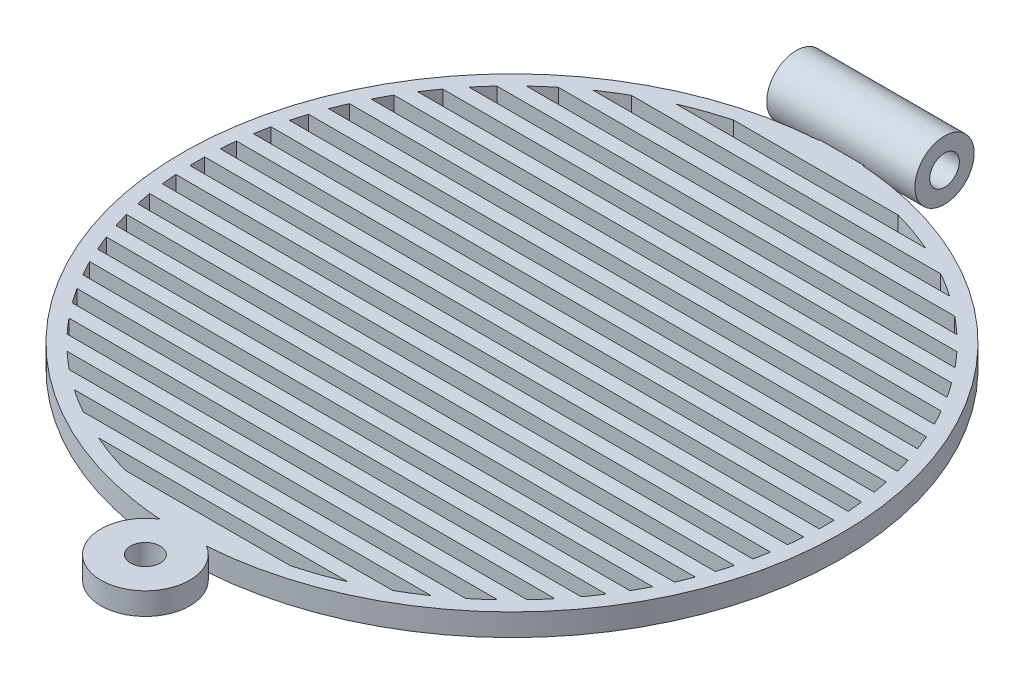
from build123d import *

# Parameters (mm, degrees)
SKETCH1_R                = 3
SKETCH1_R_2              = 1
SKETCH1_RX               = 22.24
SKETCH1_RY               = 22.24
SKETCH1_RX_2             = 21.24
SKETCH1_RY_2             = 21.24
SKETCH1_W                = 3
SKETCH1_H                = 2
BOSS_EXTRUDE1_DEPTH      = 1.5
BOSS_EXTRUDE2_DEPTH      = 5
BOSS_EXTRUDE2_DEPTH_BACK = 5
SKETCH2_R                = 2
SKETCH2_R_2              = 1
SKETCH4_R                = 1
CUT_EXTRUDE1_DEPTH       = 40.08356702
BOSS_EXTRUDE3_DEPTH      = 1.5
SKETCH6_W                = 0.2
SKETCH6_H                = 2.484462433
SKETCH6_H_2              = 1.927601492
SKETCH6_H_3              = 2
SKETCH6_H_4              = 1
SKETCH6_H_5              = 1.587936075
SKETCH6_H_6              = 2.60478701
SKETCH6_H_7              = 1.881862502
SKETCH6_H_8              = 1.513350488
BOSS_EXTRUDE4_DEPTH      = 0.5


with BuildPart() as part:
    # Sketch1 → Boss-Extrude1 (new body)
    # profile 1 of 3: a face of its own
    with BuildSketch(Plane(origin=(0, 0, 0), x_dir=(1, 0, 0), z_dir=(0, 1, 0))):
        with Locations((0, -24.74)):
            Circle(SKETCH1_R)
        with Locations(Location((0, -24.74, 0), (0, 0, 270))):
            Circle(SKETCH1_R_2, mode=Mode.SUBTRACT)
    # profile 2 of 3: a face of its own
    with BuildSketch(Plane(origin=(0, 0, 0), x_dir=(1, 0, 0), z_dir=(0, 1, 0))):
        with Locations(Location((0, 0), (0, 0, -180))):
            Ellipse(SKETCH1_RX, SKETCH1_RY)
        with Locations(Location((0, 0), (0, 0, 180))):
            Ellipse(SKETCH1_RX_2, SKETCH1_RY_2, mode=Mode.SUBTRACT)
    # profile 3 of 3: a face of its own
    with BuildSketch(Plane(origin=(0, 0, 0), x_dir=(1, 0, 0), z_dir=(0, 1, 0))):
        with Locations((0, 23.18935781)):
            Rectangle(SKETCH1_W, SKETCH1_H)
    extrude(amount=BOSS_EXTRUDE1_DEPTH)

    # Sketch2 → Boss-Extrude2 (add, two sides: drawn at the far end of the back side and taken through both)
    with BuildSketch(Plane(origin=(0, 0, 0), x_dir=(0, 0, -1), z_dir=(1, 0, 0)).offset(-BOSS_EXTRUDE2_DEPTH_BACK)):
        with Locations((24.18935781, 2)):
            Circle(SKETCH2_R)
        with Locations((24.18935781, 2)):
            Circle(SKETCH2_R_2, mode=Mode.SUBTRACT)
    extrude(amount=BOSS_EXTRUDE2_DEPTH + BOSS_EXTRUDE2_DEPTH_BACK)

    # Sketch4 → Cut-Extrude1 (cut, through all)
    with BuildSketch(Plane(origin=(5, 0, 0), x_dir=(0, 0, -1), z_dir=(1, 0, 0))):
        with Locations((24.18935781, 2)):
            Circle(SKETCH4_R)
    extrude(amount=-CUT_EXTRUDE1_DEPTH, mode=Mode.SUBTRACT)

    # Sketch5 → Boss-Extrude3 (add)
    with BuildSketch(Plane(origin=(0, 1.5, 0), x_dir=(1, 0, 0), z_dir=(0, 1, 0))):
        with BuildLine():
            Line((21.234114062, -0.5), (-21.234114062, -0.5))
            add(Edge.make_bspline(
                [(-21.234114062, -0.5), (-21.22232747, -1.000555695), (-21.186967692, -1.5)],
                knots=[3.165135318, 3.165135318, 3.165135318, 3.212272957, 3.212272957, 3.212272957], degree=2, weights=[1, 0.999722268, 1]))
            Line((-21.186967692, -1.5), (21.186967692, -1.5))
            add(Edge.make_bspline(
                [(21.186967692, -1.5), (21.22232747, -1.000555695), (21.234114062, -0.5)],
                knots=[6.212505003, 6.212505003, 6.212505003, 6.259642643, 6.259642643, 6.259642643], degree=2, weights=[1, 0.999722268, 1]))
        make_face()
        with BuildLine():
            add(Edge.make_bspline(
                [(-21.186967692, 1.5), (-21.22232747, 1.000555695), (-21.234114062, 0.5)],
                knots=[3.07091235, 3.07091235, 3.07091235, 3.118049989, 3.118049989, 3.118049989], degree=2, weights=[1, 0.999722268, 1]))
            Line((-21.234114062, 0.5), (21.234114062, 0.5))
            add(Edge.make_bspline(
                [(21.234114062, 0.5), (21.22232747, 1.000555695), (21.186967692, 1.5)],
                knots=[0.023542664, 0.023542664, 0.023542664, 0.070680304, 0.070680304, 0.070680304], degree=2, weights=[1, 0.999722268, 1]))
            Line((21.186967692, 1.5), (-21.186967692, 1.5))
        make_face()
        with BuildLine():
            add(Edge.make_bspline(
                [(-20.949644388, 3.5), (-21.032894465, 3.001697284), (-21.092358806, 2.5)],
                knots=[2.97605422, 2.97605422, 2.97605422, 3.023616725, 3.023616725, 3.023616725], degree=2, weights=[1, 0.999717239, 1]))
            Line((-21.092358806, 2.5), (21.092358806, 2.5))
            add(Edge.make_bspline(
                [(21.092358806, 2.5), (21.032894465, 3.001697284), (20.949644388, 3.5)],
                knots=[0.117975929, 0.117975929, 0.117975929, 0.165538433, 0.165538433, 0.165538433], degree=2, weights=[1, 0.999717239, 1]))
            Line((20.949644388, 3.5), (-20.949644388, 3.5))
        make_face()
        with BuildLine():
            add(Edge.make_bspline(
                [(-20.515545325, 5.5), (-20.648803138, 5.002935148), (-20.757832257, 4.5)],
                knots=[2.879662466, 2.879662466, 2.879662466, 2.928110373, 2.928110373, 2.928110373], degree=2, weights=[1, 0.999706614, 1]))
            Line((-20.757832257, 4.5), (20.757832257, 4.5))
            add(Edge.make_bspline(
                [(20.757832257, 4.5), (20.648803138, 5.002935148), (20.515545325, 5.5)],
                knots=[0.21348228, 0.21348228, 0.21348228, 0.261930188, 0.261930188, 0.261930188], degree=2, weights=[1, 0.999706614, 1]))
            Line((20.515545325, 5.5), (-20.515545325, 5.5))
        make_face()
        with BuildLine():
            add(Edge.make_bspline(
                [(-19.871778984, 7.5), (-20.058845232, 7.004354782), (-20.220969314, 6.5)],
                knots=[2.78070233, 2.78070233, 2.78070233, 2.830576322, 2.830576322, 2.830576322], degree=2, weights=[1, 0.999689089, 1]))
            Line((-20.220969314, 6.5), (20.220969314, 6.5))
            add(Edge.make_bspline(
                [(20.220969314, 6.5), (20.058845232, 7.004354782), (19.871778984, 7.5)],
                knots=[0.311016332, 0.311016332, 0.311016332, 0.360890324, 0.360890324, 0.360890324], degree=2, weights=[1, 0.999689089, 1]))
            Line((19.871778984, 7.5), (-19.871778984, 7.5))
        make_face()
        with BuildLine():
            Line((21.092358806, -2.5), (-21.092358806, -2.5))
            add(Edge.make_bspline(
                [(-21.092358806, -2.5), (-21.032894465, -3.001697284), (-20.949644388, -3.5)],
                knots=[3.259568583, 3.259568583, 3.259568583, 3.307131087, 3.307131087, 3.307131087], degree=2, weights=[1, 0.999717239, 1]))
            Line((-20.949644388, -3.5), (20.949644388, -3.5))
            add(Edge.make_bspline(
                [(20.949644388, -3.5), (21.032894465, -3.001697284), (21.092358806, -2.5)],
                knots=[6.117646874, 6.117646874, 6.117646874, 6.165209378, 6.165209378, 6.165209378], degree=2, weights=[1, 0.999717239, 1]))
        make_face()
        with BuildLine():
            Line((20.757832257, -4.5), (-20.757832257, -4.5))
            add(Edge.make_bspline(
                [(-20.757832257, -4.5), (-20.648803138, -5.002935148), (-20.515545325, -5.5)],
                knots=[3.355074934, 3.355074934, 3.355074934, 3.403522841, 3.403522841, 3.403522841], degree=2, weights=[1, 0.999706614, 1]))
            Line((-20.515545325, -5.5), (20.515545325, -5.5))
            add(Edge.make_bspline(
                [(20.515545325, -5.5), (20.648803138, -5.002935148), (20.757832257, -4.5)],
                knots=[6.021255119, 6.021255119, 6.021255119, 6.069703027, 6.069703027, 6.069703027], degree=2, weights=[1, 0.999706614, 1]))
        make_face()
        with BuildLine():
            Line((20.220969314, -6.5), (-20.220969314, -6.5))
            add(Edge.make_bspline(
                [(-20.220969314, -6.5), (-20.058845232, -7.004354782), (-19.871778984, -7.5)],
                knots=[3.452608985, 3.452608985, 3.452608985, 3.502482977, 3.502482977, 3.502482977], degree=2, weights=[1, 0.999689089, 1]))
            Line((-19.871778984, -7.5), (19.871778984, -7.5))
            add(Edge.make_bspline(
                [(19.871778984, -7.5), (20.058845232, -7.004354782), (20.220969314, -6.5)],
                knots=[5.922294984, 5.922294984, 5.922294984, 5.972168976, 5.972168976, 5.972168976], degree=2, weights=[1, 0.999689089, 1]))
        make_face()
        with BuildLine():
            Line((19.46503532, -8.5), (-19.46503532, -8.5))
            add(Edge.make_bspline(
                [(-19.46503532, -8.5), (-19.244038415, -9.00608383), (-18.997041875, -9.5)],
                knots=[3.553314987, 3.553314987, 3.553314987, 3.605302547, 3.605302547, 3.605302547], degree=2, weights=[1, 0.999662181, 1]))
            Line((-18.997041875, -9.5), (18.997041875, -9.5))
            add(Edge.make_bspline(
                [(18.997041875, -9.5), (19.244038415, -9.00608383), (19.46503532, -8.5)],
                knots=[5.819475414, 5.819475414, 5.819475414, 5.871462974, 5.871462974, 5.871462974], degree=2, weights=[1, 0.999662181, 1]))
        make_face()
        with BuildLine():
            Line((18.463141661, -10.5), (-18.463141661, -10.5))
            add(Edge.make_bspline(
                [(-18.463141661, -10.5), (-18.174049249, -11.008338491), (-17.857424226, -11.5)],
                knots=[3.658679891, 3.658679891, 3.658679891, 3.713731205, 3.713731205, 3.713731205], degree=2, weights=[1, 0.999621193, 1]))
            Line((-17.857424226, -11.5), (17.857424226, -11.5))
            add(Edge.make_bspline(
                [(17.857424226, -11.5), (18.174049249, -11.008338491), (18.463141661, -10.5)],
                knots=[5.711046756, 5.711046756, 5.711046756, 5.76609807, 5.76609807, 5.76609807], degree=2, weights=[1, 0.999621193, 1]))
        make_face()
        with BuildLine():
            Line((17.172291635, -12.5), (-17.172291635, -12.5))
            add(Edge.make_bspline(
                [(-17.172291635, -12.5), (-16.799936298, -13.011535555), (-16.397792534, -13.5)],
                knots=[3.770810085, 3.770810085, 3.770810085, 3.830369327, 3.830369327, 3.830369327], degree=2, weights=[1, 0.99955662, 1]))
            Line((-16.397792534, -13.5), (16.397792534, -13.5))
            add(Edge.make_bspline(
                [(16.397792534, -13.5), (16.799936298, -13.011535555), (17.172291635, -12.5)],
                knots=[5.594408634, 5.594408634, 5.594408634, 5.653967875, 5.653967875, 5.653967875], degree=2, weights=[1, 0.99955662, 1]))
        make_face()
        with BuildLine():
            Line((15.520554114, -14.5), (-15.520554114, -14.5))
            add(Edge.make_bspline(
                [(-15.520554114, -14.5), (-15.037904914, -15.016619518), (-14.521969563, -15.5)],
                knots=[3.893008725, 3.893008725, 3.893008725, 3.959556458, 3.959556458, 3.959556458], degree=2, weights=[1, 0.999446476, 1]))
            Line((-14.521969563, -15.5), (14.521969563, -15.5))
            add(Edge.make_bspline(
                [(14.521969563, -15.5), (15.037904914, -15.016619518), (15.520554114, -14.5)],
                knots=[5.465221503, 5.465221503, 5.465221503, 5.531769236, 5.531769236, 5.531769236], degree=2, weights=[1, 0.999446476, 1]))
        make_face()
        with BuildLine():
            Line((13.374886915, -16.5), (-13.374886915, -16.5))
            add(Edge.make_bspline(
                [(-13.374886915, -16.5), (-12.725582605, -17.026325559), (-12.036926518, -17.5)],
                knots=[4.031218439, 4.031218439, 4.031218439, 4.109881404, 4.109881404, 4.109881404], degree=2, weights=[1, 0.999226617, 1]))
            Line((-12.036926518, -17.5), (12.036926518, -17.5))
            add(Edge.make_bspline(
                [(12.036926518, -17.5), (12.725582605, -17.026325559), (13.374886915, -16.5)],
                knots=[5.314896557, 5.314896557, 5.314896557, 5.393559521, 5.393559521, 5.393559521], degree=2, weights=[1, 0.999226617, 1]))
        make_face()
        with BuildLine():
            Line((10.434922137, -18.5), (-10.434922137, -18.5))
            add(Edge.make_bspline(
                [(-10.434922137, -18.5), (-9.453718787, -19.053447598), (-8.419477418, -19.5)],
                knots=[4.198822969, 4.198822969, 4.198822969, 4.30479971, 4.30479971, 4.30479971], degree=2, weights=[1, 0.998596445, 1]))
            Line((-8.419477418, -19.5), (8.419477418, -19.5))
            add(Edge.make_bspline(
                [(8.419477418, -19.5), (9.453718787, -19.053447598), (10.434922137, -18.5)],
                knots=[5.119978251, 5.119978251, 5.119978251, 5.225954991, 5.225954991, 5.225954991], degree=2, weights=[1, 0.998596445, 1]))
        make_face()
        with BuildLine():
            Line((5.557661379, -20.5), (-5.557661379, -20.5))
            add(Edge.make_bspline(
                [(-5.557661379, -20.5), (-2.828096015, -21.24), (0, -21.24)],
                knots=[4.44764711, 4.44764711, 4.44764711, 4.71238898, 4.71238898, 4.71238898], degree=2, weights=[1, 0.991251753, 1]))
            add(Edge.make_bspline(
                [(0, -21.24), (2.828096015, -21.24), (5.557661379, -20.5)],
                knots=[4.71238898, 4.71238898, 4.71238898, 4.977130851, 4.977130851, 4.977130851], degree=2, weights=[1, 0.991251753, 1]))
        make_face()
        with BuildLine():
            add(Edge.make_bspline(
                [(-18.997041875, 9.5), (-19.244038415, 9.00608383), (-19.46503532, 8.5)],
                knots=[2.677882761, 2.677882761, 2.677882761, 2.72987032, 2.72987032, 2.72987032], degree=2, weights=[1, 0.999662181, 1]))
            Line((-19.46503532, 8.5), (19.46503532, 8.5))
            add(Edge.make_bspline(
                [(19.46503532, 8.5), (19.244038415, 9.00608383), (18.997041875, 9.5)],
                knots=[0.411722334, 0.411722334, 0.411722334, 0.463709893, 0.463709893, 0.463709893], degree=2, weights=[1, 0.999662181, 1]))
            Line((18.997041875, 9.5), (-18.997041875, 9.5))
        make_face()
        with BuildLine():
            add(Edge.make_bspline(
                [(-17.857424226, 11.5), (-18.174049249, 11.008338491), (-18.463141661, 10.5)],
                knots=[2.569454102, 2.569454102, 2.569454102, 2.624505416, 2.624505416, 2.624505416], degree=2, weights=[1, 0.999621193, 1]))
            Line((-18.463141661, 10.5), (18.463141661, 10.5))
            add(Edge.make_bspline(
                [(18.463141661, 10.5), (18.174049249, 11.008338491), (17.857424226, 11.5)],
                knots=[0.517087238, 0.517087238, 0.517087238, 0.572138551, 0.572138551, 0.572138551], degree=2, weights=[1, 0.999621193, 1]))
            Line((17.857424226, 11.5), (-17.857424226, 11.5))
        make_face()
        with BuildLine():
            add(Edge.make_bspline(
                [(-16.397792534, 13.5), (-16.799936298, 13.011535555), (-17.172291635, 12.5)],
                knots=[2.45281598, 2.45281598, 2.45281598, 2.512375222, 2.512375222, 2.512375222], degree=2, weights=[1, 0.99955662, 1]))
            Line((-17.172291635, 12.5), (17.172291635, 12.5))
            add(Edge.make_bspline(
                [(17.172291635, 12.5), (16.799936298, 13.011535555), (16.397792534, 13.5)],
                knots=[0.629217432, 0.629217432, 0.629217432, 0.688776673, 0.688776673, 0.688776673], degree=2, weights=[1, 0.99955662, 1]))
            Line((16.397792534, 13.5), (-16.397792534, 13.5))
        make_face()
        with BuildLine():
            add(Edge.make_bspline(
                [(-14.521969563, 15.5), (-15.037904914, 15.016619518), (-15.520554114, 14.5)],
                knots=[2.32362885, 2.32362885, 2.32362885, 2.390176583, 2.390176583, 2.390176583], degree=2, weights=[1, 0.999446476, 1]))
            Line((-15.520554114, 14.5), (15.520554114, 14.5))
            add(Edge.make_bspline(
                [(15.520554114, 14.5), (15.037904914, 15.016619518), (14.521969563, 15.5)],
                knots=[0.751416071, 0.751416071, 0.751416071, 0.817963804, 0.817963804, 0.817963804], degree=2, weights=[1, 0.999446476, 1]))
            Line((14.521969563, 15.5), (-14.521969563, 15.5))
        make_face()
        with BuildLine():
            add(Edge.make_bspline(
                [(-12.036926518, 17.5), (-12.725582605, 17.026325559), (-13.374886915, 16.5)],
                knots=[2.173303903, 2.173303903, 2.173303903, 2.251966868, 2.251966868, 2.251966868], degree=2, weights=[1, 0.999226617, 1]))
            Line((-13.374886915, 16.5), (13.374886915, 16.5))
            add(Edge.make_bspline(
                [(13.374886915, 16.5), (12.725582605, 17.026325559), (12.036926518, 17.5)],
                knots=[0.889625786, 0.889625786, 0.889625786, 0.96828875, 0.96828875, 0.96828875], degree=2, weights=[1, 0.999226617, 1]))
            Line((12.036926518, 17.5), (-12.036926518, 17.5))
        make_face()
        with BuildLine():
            add(Edge.make_bspline(
                [(-8.419477418, 19.5), (-9.453718787, 19.053447598), (-10.434922137, 18.5)],
                knots=[1.978385598, 1.978385598, 1.978385598, 2.084362338, 2.084362338, 2.084362338], degree=2, weights=[1, 0.998596445, 1]))
            Line((-10.434922137, 18.5), (10.434922137, 18.5))
            add(Edge.make_bspline(
                [(10.434922137, 18.5), (9.453718787, 19.053447598), (8.419477418, 19.5)],
                knots=[1.057230316, 1.057230316, 1.057230316, 1.163207056, 1.163207056, 1.163207056], degree=2, weights=[1, 0.998596445, 1]))
            Line((8.419477418, 19.5), (-8.419477418, 19.5))
        make_face()
        with BuildLine():
            add(Edge.make_bspline(
                [(5.557661379, 20.5), (0, 22.006712195), (-5.557661379, 20.5)],
                knots=[1.306054457, 1.306054457, 1.306054457, 1.835538197, 1.835538197, 1.835538197], degree=2, weights=[1, 0.965160075, 1]))
            Line((-5.557661379, 20.5), (5.557661379, 20.5))
        make_face()
    extrude(amount=-BOSS_EXTRUDE3_DEPTH)

    # Sketch6 → Boss-Extrude4 (add)
    with BuildSketch(Plane.XZ):
        with Locations((0, 18.257768784)):
            Rectangle(SKETCH6_W, SKETCH6_H)
        with Locations((10, 16.051736821)):
            Rectangle(SKETCH6_W, SKETCH6_H_2)
        with Locations((8, -9.5)):
            Rectangle(SKETCH6_W, SKETCH6_H_3)
        with Locations((2, 20)):
            Rectangle(SKETCH6_W, SKETCH6_H_4)
        with Locations((4, 18.257768784)):
            Rectangle(SKETCH6_W, SKETCH6_H)
        with Locations((6, 20)):
            Rectangle(SKETCH6_W, SKETCH6_H_4)
        with Locations((8, 18.257768784)):
            Rectangle(SKETCH6_W, SKETCH6_H)
        with Locations((12, 14.293968038)):
            Rectangle(SKETCH6_W, SKETCH6_H_5)
        with Locations((14, 16.051736821)):
            Rectangle(SKETCH6_W, SKETCH6_H_2)
        with Locations((16, 14.293968038)):
            Rectangle(SKETCH6_W, SKETCH6_H_5)
        with Locations((8, 14.293968038)):
            Rectangle(SKETCH6_W, SKETCH6_H_5)
        with Locations((-2, 20)):
            Rectangle(SKETCH6_W, SKETCH6_H_4)
        with Locations((-4, 18.257768784)):
            Rectangle(SKETCH6_W, SKETCH6_H)
        with Locations((-6, 20)):
            Rectangle(SKETCH6_W, SKETCH6_H_4)
        with Locations((-8, 18.197606495)):
            Rectangle(SKETCH6_W, SKETCH6_H_6)
        with Locations((-10, 15.954281739)):
            Rectangle(SKETCH6_W, SKETCH6_H_7)
        with Locations((-12, 14.256675244)):
            Rectangle(SKETCH6_W, SKETCH6_H_8)
        with Locations((-14, 15.954281739)):
            Rectangle(SKETCH6_W, SKETCH6_H_7)
        with Locations((-16, 14.256675244)):
            Rectangle(SKETCH6_W, SKETCH6_H_8)
        with Locations((-18, 8.5)):
            Rectangle(SKETCH6_W, SKETCH6_H_3)
        with Locations((-20, 6.5)):
            Rectangle(SKETCH6_W, SKETCH6_H_3)
        with Locations((-20, -1.5)):
            Rectangle(SKETCH6_W, SKETCH6_H_3)
        with Locations((-20, 2.5)):
            Rectangle(SKETCH6_W, SKETCH6_H_3)
        with Locations((-14, 8.5)):
            Rectangle(SKETCH6_W, SKETCH6_H_3)
        with Locations((-18, 0.5)):
            Rectangle(SKETCH6_W, SKETCH6_H_3)
        with Locations((-8, 14.256675244)):
            Rectangle(SKETCH6_W, SKETCH6_H_8)
        with Locations((-20, -5.5)):
            Rectangle(SKETCH6_W, SKETCH6_H_3)
        with Locations((-18, -11.5)):
            Rectangle(SKETCH6_W, SKETCH6_H_3)
        with Locations((4, -9.5)):
            Rectangle(SKETCH6_W, SKETCH6_H_3)
        with Locations((6, -7.5)):
            Rectangle(SKETCH6_W, SKETCH6_H_3)
        with Locations((-12, -17.5)):
            Rectangle(SKETCH6_W, SKETCH6_H_3)
        with Locations((0, 2.5)):
            Rectangle(SKETCH6_W, SKETCH6_H_3)
        with Locations((2, 4.5)):
            Rectangle(SKETCH6_W, SKETCH6_H_3)
        with Locations((2, 0.5)):
            Rectangle(SKETCH6_W, SKETCH6_H_3)
        with Locations((0, -1.5)):
            Rectangle(SKETCH6_W, SKETCH6_H_3)
        with Locations((-2, 0.5)):
            Rectangle(SKETCH6_W, SKETCH6_H_3)
        with Locations((-2, 4.5)):
            Rectangle(SKETCH6_W, SKETCH6_H_3)
        with Locations((0, 6.5)):
            Rectangle(SKETCH6_W, SKETCH6_H_3)
        with Locations((4, 6.5)):
            Rectangle(SKETCH6_W, SKETCH6_H_3)
        with Locations((4, 2.5)):
            Rectangle(SKETCH6_W, SKETCH6_H_3)
        with Locations((2, 8.5)):
            Rectangle(SKETCH6_W, SKETCH6_H_3)
        with Locations((-2, 8.5)):
            Rectangle(SKETCH6_W, SKETCH6_H_3)
        with Locations((0, 10.5)):
            Rectangle(SKETCH6_W, SKETCH6_H_3)
        with Locations((4, 10.5)):
            Rectangle(SKETCH6_W, SKETCH6_H_3)
        with Locations((4, -1.5)):
            Rectangle(SKETCH6_W, SKETCH6_H_3)
        with Locations((2, -3.5)):
            Rectangle(SKETCH6_W, SKETCH6_H_3)
        with Locations((0, -5.5)):
            Rectangle(SKETCH6_W, SKETCH6_H_3)
        with Locations((-2, -3.5)):
            Rectangle(SKETCH6_W, SKETCH6_H_3)
        with Locations((-4, -1.5)):
            Rectangle(SKETCH6_W, SKETCH6_H_3)
        with Locations((-4, 2.5)):
            Rectangle(SKETCH6_W, SKETCH6_H_3)
        with Locations((-6, 0.5)):
            Rectangle(SKETCH6_W, SKETCH6_H_3)
        with Locations((-6, 4.5)):
            Rectangle(SKETCH6_W, SKETCH6_H_3)
        with Locations((-4, 6.5)):
            Rectangle(SKETCH6_W, SKETCH6_H_3)
        with Locations((-6, 8.5)):
            Rectangle(SKETCH6_W, SKETCH6_H_3)
        with Locations((-4, 10.5)):
            Rectangle(SKETCH6_W, SKETCH6_H_3)
        with Locations((-2, 12.5)):
            Rectangle(SKETCH6_W, SKETCH6_H_3)
        with Locations((-6, 12.5)):
            Rectangle(SKETCH6_W, SKETCH6_H_3)
        with Locations((-4, 14.293968038)):
            Rectangle(SKETCH6_W, SKETCH6_H_5)
        with Locations((-2, 16.051736821)):
            Rectangle(SKETCH6_W, SKETCH6_H_2)
        with Locations((-6, 16.5)):
            Rectangle(SKETCH6_W, SKETCH6_H_3)
        with Locations((0, 14.293968038)):
            Rectangle(SKETCH6_W, SKETCH6_H_5)
        with Locations((2, 12.5)):
            Rectangle(SKETCH6_W, SKETCH6_H_3)
        with Locations((4, 14.293968038)):
            Rectangle(SKETCH6_W, SKETCH6_H_5)
        with Locations((2, 16.051736821)):
            Rectangle(SKETCH6_W, SKETCH6_H_2)
        with Locations((6, 16.051736821)):
            Rectangle(SKETCH6_W, SKETCH6_H_2)
        with Locations((6, 12.5)):
            Rectangle(SKETCH6_W, SKETCH6_H_3)
        with Locations((16, 6.5)):
            Rectangle(SKETCH6_W, SKETCH6_H_3)
        with Locations((20, 6.5)):
            Rectangle(SKETCH6_W, SKETCH6_H_3)
        with Locations((10, 12.5)):
            Rectangle(SKETCH6_W, SKETCH6_H_3)
        with Locations((14, 12.5)):
            Rectangle(SKETCH6_W, SKETCH6_H_3)
        with Locations((8, 10.5)):
            Rectangle(SKETCH6_W, SKETCH6_H_3)
        with Locations((12, 10.5)):
            Rectangle(SKETCH6_W, SKETCH6_H_3)
        with Locations((16, 10.5)):
            Rectangle(SKETCH6_W, SKETCH6_H_3)
        with Locations((6, 8.5)):
            Rectangle(SKETCH6_W, SKETCH6_H_3)
        with Locations((10, 8.5)):
            Rectangle(SKETCH6_W, SKETCH6_H_3)
        with Locations((14, 8.5)):
            Rectangle(SKETCH6_W, SKETCH6_H_3)
        with Locations((18, 8.5)):
            Rectangle(SKETCH6_W, SKETCH6_H_3)
        with Locations((8, 6.5)):
            Rectangle(SKETCH6_W, SKETCH6_H_3)
        with Locations((12, 6.5)):
            Rectangle(SKETCH6_W, SKETCH6_H_3)
        with Locations((18, 4.5)):
            Rectangle(SKETCH6_W, SKETCH6_H_3)
        with Locations((14, 4.5)):
            Rectangle(SKETCH6_W, SKETCH6_H_3)
        with Locations((10, 4.5)):
            Rectangle(SKETCH6_W, SKETCH6_H_3)
        with Locations((6, 4.5)):
            Rectangle(SKETCH6_W, SKETCH6_H_3)
        with Locations((8, 2.5)):
            Rectangle(SKETCH6_W, SKETCH6_H_3)
        with Locations((12, 2.5)):
            Rectangle(SKETCH6_W, SKETCH6_H_3)
        with Locations((16, 2.5)):
            Rectangle(SKETCH6_W, SKETCH6_H_3)
        with Locations((20, 2.5)):
            Rectangle(SKETCH6_W, SKETCH6_H_3)
        with Locations((18, 0.5)):
            Rectangle(SKETCH6_W, SKETCH6_H_3)
        with Locations((14, 0.5)):
            Rectangle(SKETCH6_W, SKETCH6_H_3)
        with Locations((10, 0.5)):
            Rectangle(SKETCH6_W, SKETCH6_H_3)
        with Locations((6, 0.5)):
            Rectangle(SKETCH6_W, SKETCH6_H_3)
        with Locations((8, -1.5)):
            Rectangle(SKETCH6_W, SKETCH6_H_3)
        with Locations((12, -1.5)):
            Rectangle(SKETCH6_W, SKETCH6_H_3)
        with Locations((16, -1.5)):
            Rectangle(SKETCH6_W, SKETCH6_H_3)
        with Locations((20, -1.5)):
            Rectangle(SKETCH6_W, SKETCH6_H_3)
        with Locations((18, -3.5)):
            Rectangle(SKETCH6_W, SKETCH6_H_3)
        with Locations((14, -3.5)):
            Rectangle(SKETCH6_W, SKETCH6_H_3)
        with Locations((10, -3.5)):
            Rectangle(SKETCH6_W, SKETCH6_H_3)
        with Locations((6, -3.5)):
            Rectangle(SKETCH6_W, SKETCH6_H_3)
        with Locations((-8, 10.5)):
            Rectangle(SKETCH6_W, SKETCH6_H_3)
        with Locations((-6, -7.5)):
            Rectangle(SKETCH6_W, SKETCH6_H_3)
        with Locations((-6, -11.5)):
            Rectangle(SKETCH6_W, SKETCH6_H_3)
        with Locations((-8, 6.5)):
            Rectangle(SKETCH6_W, SKETCH6_H_3)
        with Locations((-8, 2.5)):
            Rectangle(SKETCH6_W, SKETCH6_H_3)
        with Locations((-8, -1.5)):
            Rectangle(SKETCH6_W, SKETCH6_H_3)
        with Locations((-8, -5.5)):
            Rectangle(SKETCH6_W, SKETCH6_H_3)
        with Locations((-6, -3.5)):
            Rectangle(SKETCH6_W, SKETCH6_H_3)
        with Locations((-8, -9.5)):
            Rectangle(SKETCH6_W, SKETCH6_H_3)
        with Locations((-8, -13.5)):
            Rectangle(SKETCH6_W, SKETCH6_H_3)
        with Locations((-6, -15.5)):
            Rectangle(SKETCH6_W, SKETCH6_H_3)
        with Locations((-4, -5.5)):
            Rectangle(SKETCH6_W, SKETCH6_H_3)
        with Locations((-4, -9.5)):
            Rectangle(SKETCH6_W, SKETCH6_H_3)
        with Locations((-4, -13.5)):
            Rectangle(SKETCH6_W, SKETCH6_H_3)
        with Locations((-2, -7.5)):
            Rectangle(SKETCH6_W, SKETCH6_H_3)
        with Locations((0, -9.5)):
            Rectangle(SKETCH6_W, SKETCH6_H_3)
        with Locations((-2, -11.5)):
            Rectangle(SKETCH6_W, SKETCH6_H_3)
        with Locations((-2, -15.5)):
            Rectangle(SKETCH6_W, SKETCH6_H_3)
        with Locations((2, -7.5)):
            Rectangle(SKETCH6_W, SKETCH6_H_3)
        with Locations((0, -13.5)):
            Rectangle(SKETCH6_W, SKETCH6_H_3)
        with Locations((2, -11.5)):
            Rectangle(SKETCH6_W, SKETCH6_H_3)
        with Locations((4, -5.5)):
            Rectangle(SKETCH6_W, SKETCH6_H_3)
        with Locations((8, -5.5)):
            Rectangle(SKETCH6_W, SKETCH6_H_3)
        with Locations((12, -5.5)):
            Rectangle(SKETCH6_W, SKETCH6_H_3)
        with Locations((16, -5.5)):
            Rectangle(SKETCH6_W, SKETCH6_H_3)
        with Locations((20, -5.5)):
            Rectangle(SKETCH6_W, SKETCH6_H_3)
        with Locations((18, -7.5)):
            Rectangle(SKETCH6_W, SKETCH6_H_3)
        with Locations((14, -7.5)):
            Rectangle(SKETCH6_W, SKETCH6_H_3)
        with Locations((10, -7.5)):
            Rectangle(SKETCH6_W, SKETCH6_H_3)
        with Locations((-10, 12.5)):
            Rectangle(SKETCH6_W, SKETCH6_H_3)
        with Locations((-12, 10.5)):
            Rectangle(SKETCH6_W, SKETCH6_H_3)
        with Locations((-14, 12.5)):
            Rectangle(SKETCH6_W, SKETCH6_H_3)
        with Locations((-16, 10.5)):
            Rectangle(SKETCH6_W, SKETCH6_H_3)
        with Locations((-10, 8.5)):
            Rectangle(SKETCH6_W, SKETCH6_H_3)
        with Locations((-12, 6.5)):
            Rectangle(SKETCH6_W, SKETCH6_H_3)
        with Locations((-12, 2.5)):
            Rectangle(SKETCH6_W, SKETCH6_H_3)
        with Locations((-10, 4.5)):
            Rectangle(SKETCH6_W, SKETCH6_H_3)
        with Locations((-14, 4.5)):
            Rectangle(SKETCH6_W, SKETCH6_H_3)
        with Locations((-14, 0.5)):
            Rectangle(SKETCH6_W, SKETCH6_H_3)
        with Locations((-16, 6.5)):
            Rectangle(SKETCH6_W, SKETCH6_H_3)
        with Locations((-18, 4.5)):
            Rectangle(SKETCH6_W, SKETCH6_H_3)
        with Locations((-16, 2.5)):
            Rectangle(SKETCH6_W, SKETCH6_H_3)
        with Locations((-10, 0.5)):
            Rectangle(SKETCH6_W, SKETCH6_H_3)
        with Locations((-16, -1.5)):
            Rectangle(SKETCH6_W, SKETCH6_H_3)
        with Locations((-12, -1.5)):
            Rectangle(SKETCH6_W, SKETCH6_H_3)
        with Locations((-10, -3.5)):
            Rectangle(SKETCH6_W, SKETCH6_H_3)
        with Locations((-14, -3.5)):
            Rectangle(SKETCH6_W, SKETCH6_H_3)
        with Locations((-18, -3.5)):
            Rectangle(SKETCH6_W, SKETCH6_H_3)
        with Locations((-16, -5.5)):
            Rectangle(SKETCH6_W, SKETCH6_H_3)
        with Locations((-12, -5.5)):
            Rectangle(SKETCH6_W, SKETCH6_H_3)
        with Locations((-10, -7.5)):
            Rectangle(SKETCH6_W, SKETCH6_H_3)
        with Locations((-14, -7.5)):
            Rectangle(SKETCH6_W, SKETCH6_H_3)
        with Locations((-18, -7.5)):
            Rectangle(SKETCH6_W, SKETCH6_H_3)
        with Locations((6, -11.5)):
            Rectangle(SKETCH6_W, SKETCH6_H_3)
        with Locations((4, -13.5)):
            Rectangle(SKETCH6_W, SKETCH6_H_3)
        with Locations((-12, -9.5)):
            Rectangle(SKETCH6_W, SKETCH6_H_3)
        with Locations((-16, -9.5)):
            Rectangle(SKETCH6_W, SKETCH6_H_3)
        with Locations((-14, -11.5)):
            Rectangle(SKETCH6_W, SKETCH6_H_3)
        with Locations((-10, -11.5)):
            Rectangle(SKETCH6_W, SKETCH6_H_3)
        with Locations((-14, -15.5)):
            Rectangle(SKETCH6_W, SKETCH6_H_3)
        with Locations((4, -17.5)):
            Rectangle(SKETCH6_W, SKETCH6_H_3)
        with Locations((6, -15.5)):
            Rectangle(SKETCH6_W, SKETCH6_H_3)
        with Locations((2, -15.5)):
            Rectangle(SKETCH6_W, SKETCH6_H_3)
        with Locations((2, -19.5)):
            Rectangle(SKETCH6_W, SKETCH6_H_3)
        with Locations((6, -19.5)):
            Rectangle(SKETCH6_W, SKETCH6_H_3)
        with Locations((8, -13.5)):
            Rectangle(SKETCH6_W, SKETCH6_H_3)
        with Locations((8, -17.5)):
            Rectangle(SKETCH6_W, SKETCH6_H_3)
        with Locations((-16, -13.5)):
            Rectangle(SKETCH6_W, SKETCH6_H_3)
        with Locations((-12, -13.5)):
            Rectangle(SKETCH6_W, SKETCH6_H_3)
        with Locations((-10, -15.5)):
            Rectangle(SKETCH6_W, SKETCH6_H_3)
        with Locations((-8, -17.5)):
            Rectangle(SKETCH6_W, SKETCH6_H_3)
        with Locations((-4, -17.5)):
            Rectangle(SKETCH6_W, SKETCH6_H_3)
        with Locations((-2, -19.5)):
            Rectangle(SKETCH6_W, SKETCH6_H_3)
        with Locations((-6, -19.5)):
            Rectangle(SKETCH6_W, SKETCH6_H_3)
        with Locations((0, -17.5)):
            Rectangle(SKETCH6_W, SKETCH6_H_3)
        with Locations((12, -17.5)):
            Rectangle(SKETCH6_W, SKETCH6_H_3)
        with Locations((10, -11.5)):
            Rectangle(SKETCH6_W, SKETCH6_H_3)
        with Locations((12, -9.5)):
            Rectangle(SKETCH6_W, SKETCH6_H_3)
        with Locations((12, -13.5)):
            Rectangle(SKETCH6_W, SKETCH6_H_3)
        with Locations((14, -11.5)):
            Rectangle(SKETCH6_W, SKETCH6_H_3)
        with Locations((14, -15.5)):
            Rectangle(SKETCH6_W, SKETCH6_H_3)
        with Locations((16, -9.5)):
            Rectangle(SKETCH6_W, SKETCH6_H_3)
        with Locations((16, -13.5)):
            Rectangle(SKETCH6_W, SKETCH6_H_3)
        with Locations((18, -11.5)):
            Rectangle(SKETCH6_W, SKETCH6_H_3)
        with Locations((10, -15.5)):
            Rectangle(SKETCH6_W, SKETCH6_H_3)
    extrude(amount=-BOSS_EXTRUDE4_DEPTH)


solid = part.part
